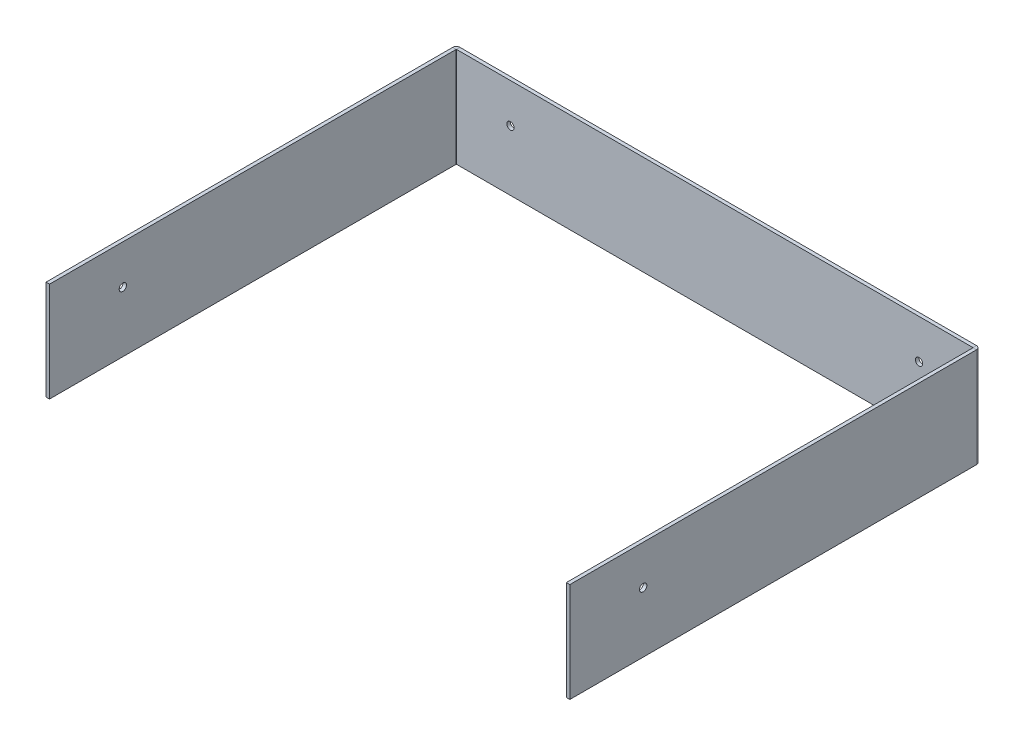
from build123d import *

# Parameters (mm, degrees)
SKIZZE1_W                       = 300
SKIZZE1_H                       = 57
SKIZZE1_R                       = 2.1
BASIS_BLECH1_DEPTH              = 2
KANTE_LASCHE1_STRIP_W           = 8.2
KANTE_LASCHE1_STRIP_H           = 2
KANTE_LASCHE1_STRIP_CUT_DEPTH   = 57
KANTE_LASCHE1_STRIP_2_W         = 8.2
KANTE_LASCHE1_STRIP_2_H         = 2
KANTE_LASCHE1_STRIP_CUT_2_DEPTH = 57
KANTE_LASCHE1_DEPTH             = 57
KANTE_LASCHE1_BEND_DEPTH        = 57
SKIZZE10_R                      = 2.1
SCHNITT_LINEAR_AUSTRAGEN1_DEPTH = 381.921579856


# Sheet-metal steps are written as plain solids
with BuildPart() as part:
    # Skizze1 → Basis-Blech1 (new body)
    with BuildSketch(Plane.XY):
        Rectangle(SKIZZE1_W, SKIZZE1_H)
        with Locations((-117, 6)):
            Circle(SKIZZE1_R, mode=Mode.SUBTRACT)
        with Locations((117, 6)):
            Circle(SKIZZE1_R, mode=Mode.SUBTRACT)
    extrude(amount=-BASIS_BLECH1_DEPTH)

    # Kante-Lasche1 strip (across the edge) → Kante-Lasche1 strip cut (cut)
    with BuildSketch(Plane(origin=(-150, 28.5, 0), x_dir=(1, 0, 0), z_dir=(0, -1, 0))):
        with Locations((-2, -1)):
            Rectangle(KANTE_LASCHE1_STRIP_W, KANTE_LASCHE1_STRIP_H)
    extrude(amount=KANTE_LASCHE1_STRIP_CUT_DEPTH, mode=Mode.SUBTRACT)

    # Kante-Lasche1 strip 2 (across the edge) → Kante-Lasche1 strip cut 2 (cut)
    with BuildSketch(Plane(origin=(150, -28.5, 0), x_dir=(-1, 0, 0), z_dir=(0, 1, 0))):
        with Locations((-2, -1)):
            Rectangle(KANTE_LASCHE1_STRIP_2_W, KANTE_LASCHE1_STRIP_2_H)
    extrude(amount=KANTE_LASCHE1_STRIP_CUT_2_DEPTH, mode=Mode.SUBTRACT)

    # Kante-Lasche1 section (across the edge) → Kante-Lasche1 (add)
    with BuildSketch(Plane(origin=(-150, 28.5, 0), x_dir=(1, 0, 0), z_dir=(0, -1, 0))):
        with BuildLine():
            Line((0, 0.1), (0, 233))
            Line((0, 233), (2, 233))
            Line((2, 233), (2, 0.1))
            ThreePointArc((2, 0.1), (2.029289322, 0.029289322), (2.1, 0))
            Line((2.1, 0), (2.1, -2))
            ThreePointArc((2.1, -2), (0.61507576, -1.38492424), (0, 0.1))
        make_face()
    extrude(amount=KANTE_LASCHE1_DEPTH)

    # Kante-Lasche1 section 2 (across the edge) → Kante-Lasche1 bend (add)
    with BuildSketch(Plane(origin=(150, -28.5, 0), x_dir=(-1, 0, 0), z_dir=(0, 1, 0))):
        with BuildLine():
            Line((0, 0.1), (0, 233))
            Line((0, 233), (2, 233))
            Line((2, 233), (2, 0.1))
            ThreePointArc((2, 0.1), (2.029289322, 0.029289322), (2.1, 0))
            Line((2.1, 0), (2.1, -2))
            ThreePointArc((2.1, -2), (0.61507576, -1.38492424), (0, 0.1))
        make_face()
    extrude(amount=KANTE_LASCHE1_BEND_DEPTH)

    # Skizze10 → Schnitt-Linear austragen1 (cut, through all)
    with BuildSketch(Plane(origin=(150, 0, 0), x_dir=(0, 0, -1), z_dir=(1, 0, 0))):
        with Locations((-191, 6)):
            Circle(SKIZZE10_R)
    extrude(amount=-SCHNITT_LINEAR_AUSTRAGEN1_DEPTH, mode=Mode.SUBTRACT)


solid = part.part
